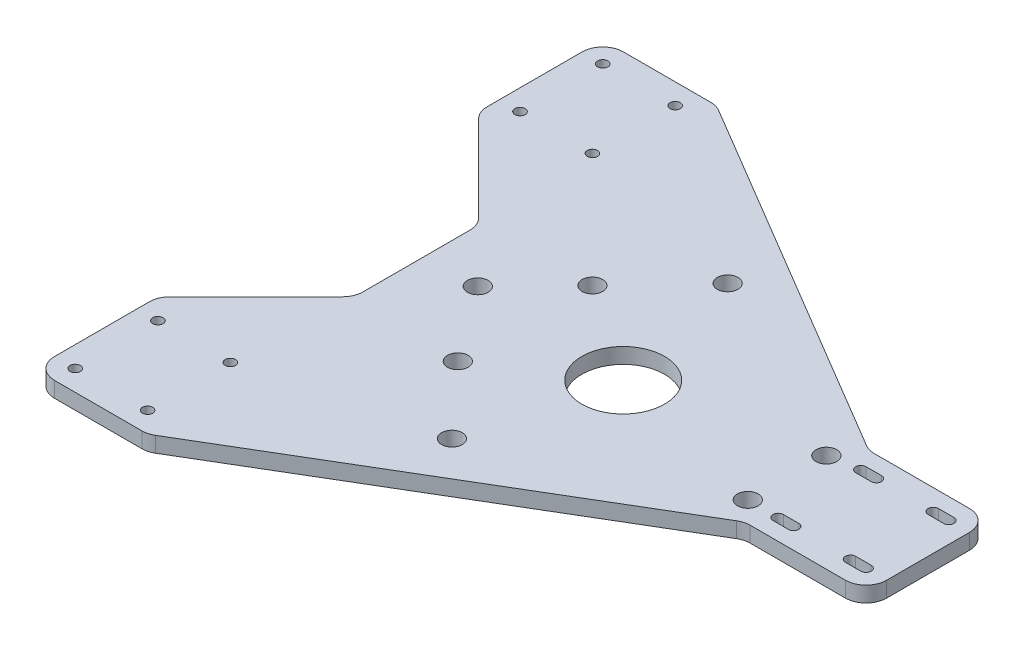
from build123d import *

# Parameters (mm, degrees)
ESQUISSE1_W             = 117.9
ESQUISSE1_H             = 110
BOSS_EXTRU_1_DEPTH      = 3
ESQUISSE2_R             = 1
ENL_V_MAT_EXTRU_1_DEPTH = 81.679009042
CONG_1_R                = 4
ESQUISSE3_R             = 8
ENL_V_MAT_EXTRU_2_DEPTH = 81.679009042
ESQUISSE6_R             = 2
ENL_V_MAT_EXTRU_3_DEPTH = 81.679009042


with BuildPart() as part:
    # Esquisse1 → Boss.-Extru.1 (new body)
    with BuildSketch(Plane(origin=(0, 0, 0), x_dir=(1, 0, 0), z_dir=(0, 1, 0))):
        Rectangle(ESQUISSE1_W, ESQUISSE1_H)
    extrude(amount=BOSS_EXTRU_1_DEPTH)

    # Esquisse2 → Enlèv. mat.-Extru.1 (cut, through all)
    with BuildSketch(Plane(origin=(0, 0, 0), x_dir=(1, 0, 0), z_dir=(0, 1, 0))):
        with Locations((-40.95, -35)):
            Circle(ESQUISSE2_R)
        with Locations((-54.95, -35)):
            Circle(ESQUISSE2_R)
        with Locations((-54.95, -51)):
            Circle(ESQUISSE2_R)
        with Locations((-40.95, -51)):
            Circle(ESQUISSE2_R)
        with Locations((-40.95, 51)):
            Circle(ESQUISSE2_R)
        with Locations((-54.95, 51)):
            Circle(ESQUISSE2_R)
        with Locations((-54.95, 35)):
            Circle(ESQUISSE2_R)
        with Locations((-40.95, 35)):
            Circle(ESQUISSE2_R)
        Polygon((58.95, 12), (35.45, 12), (-36.95, 55), (58.95, 55), align=None)
        Polygon((58.95, -12), (35.45, -12), (-36.95, -55), (58.95, -55), align=None)
        Polygon((-58.95, -31), (-39.95, -12), (-39.95, 12), (-58.95, 31), align=None)
        with BuildLine():
            Line((37.95, 9), (40.95, 9))
            ThreePointArc((40.95, 9), (41.95, 8), (40.95, 7))
            Line((40.95, 7), (37.95, 7))
            ThreePointArc((37.95, 7), (36.95, 8), (37.95, 9))
        make_face()
        with BuildLine():
            Line((54.95, 7), (51.95, 7))
            ThreePointArc((51.95, 7), (50.95, 8), (51.95, 9))
            Line((51.95, 9), (54.95, 9))
            ThreePointArc((54.95, 9), (55.95, 8), (54.95, 7))
        make_face()
        with BuildLine():
            Line((37.95, -7), (40.95, -7))
            ThreePointArc((40.95, -7), (41.95, -8), (40.95, -9))
            Line((40.95, -9), (37.95, -9))
            ThreePointArc((37.95, -9), (36.95, -8), (37.95, -7))
        make_face()
        with BuildLine():
            Line((54.95, -9), (51.95, -9))
            ThreePointArc((51.95, -9), (50.95, -8), (51.95, -7))
            Line((51.95, -7), (54.95, -7))
            ThreePointArc((54.95, -7), (55.95, -8), (54.95, -9))
        make_face()
    extrude(amount=ENL_V_MAT_EXTRU_1_DEPTH, mode=Mode.SUBTRACT)

    # Congé1
    cong_1_edges = [part.edges().sort_by_distance(p)[0] for p in [
        (35.45, 1.5, 12),
        (58.95, 1.5, 12),
        (58.95, 1.5, -12),
        (35.45, 1.5, -12),
        (-36.95, 1.5, -55),
        (-58.95, 1.5, -55),
        (-58.95, 1.5, -31),
        (-39.95, 1.5, -12),
        (-39.95, 1.5, 12),
        (-58.95, 1.5, 31),
        (-58.95, 1.5, 55),
        (-36.95, 1.5, 55),
    ]]
    fillet(cong_1_edges, radius=CONG_1_R)

    # Esquisse3 → Enlèv. mat.-Extru.2 (cut, through all)
    with BuildSketch(Plane(origin=(0, 0, 0), x_dir=(1, 0, 0), z_dir=(0, 1, 0))):
        Circle(ESQUISSE3_R)
    extrude(amount=ENL_V_MAT_EXTRU_2_DEPTH, mode=Mode.SUBTRACT)

    # Esquisse6 → Enlèv. mat.-Extru.3 (cut, through all)
    with BuildSketch(Plane.XZ):
        with Locations((32.258268348, -7.015871386)):
            Circle(ESQUISSE6_R)
        with Locations((32.073171502, 7.982986542)):
            Circle(ESQUISSE6_R)
        with Locations((-6.775016521, 26.331929262)):
            Circle(ESQUISSE6_R)
        with Locations((-6.125279104, -26.317910049)):
            Circle(ESQUISSE6_R)
        with Locations((-18.842455036, -12.883492858)):
            Circle(ESQUISSE6_R)
        with Locations((-19.159587632, 12.814550393)):
            Circle(ESQUISSE6_R)
        with Locations((-29.781689358, -1.667626755)):
            Circle(ESQUISSE6_R)
    extrude(amount=-ENL_V_MAT_EXTRU_3_DEPTH, mode=Mode.SUBTRACT)


solid = part.part
